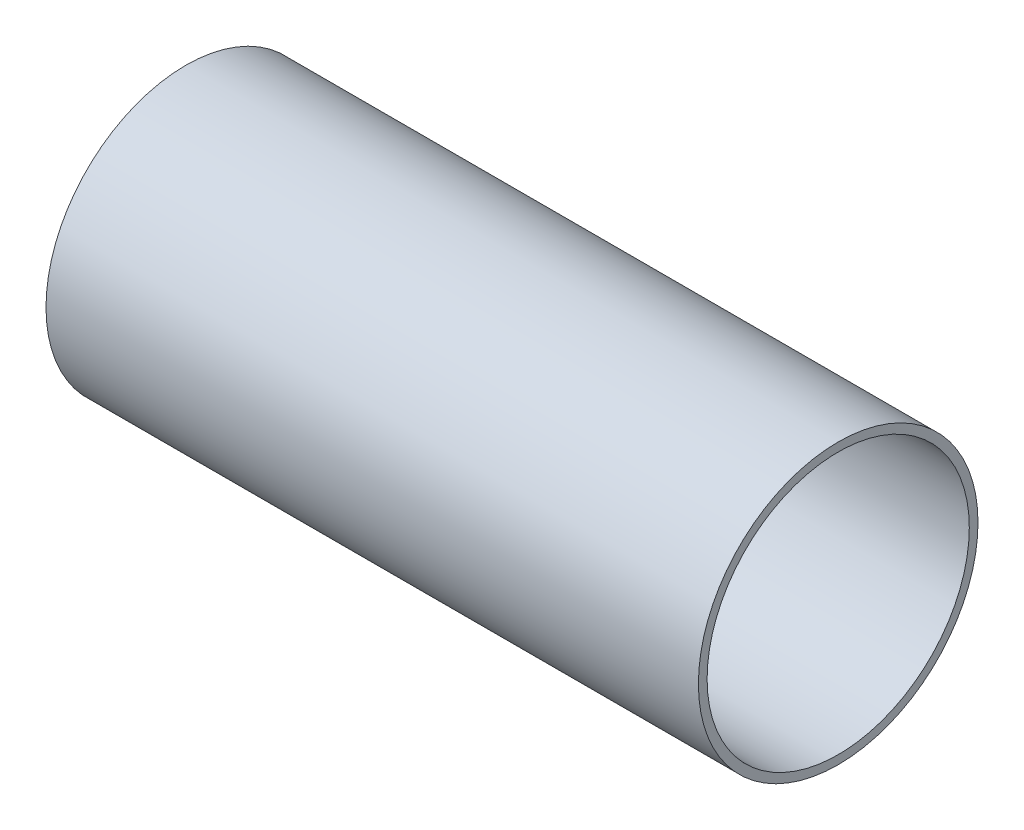
from build123d import *

# Parameters (mm, degrees)
SKETCH1_R           = 14.2875
SKETCH1_R_2         = 13.3985
BOSS_EXTRUDE1_DEPTH = 33.3375


with BuildPart() as part:
    # Sketch1 → Boss-Extrude1 (new, symmetric)
    with BuildSketch(Plane(origin=(0, 0, 0), x_dir=(0, 0, -1), z_dir=(1, 0, 0))):
        Circle(SKETCH1_R)
        Circle(SKETCH1_R_2, mode=Mode.SUBTRACT)
    extrude(amount=BOSS_EXTRUDE1_DEPTH, both=True)


solid = part.part
